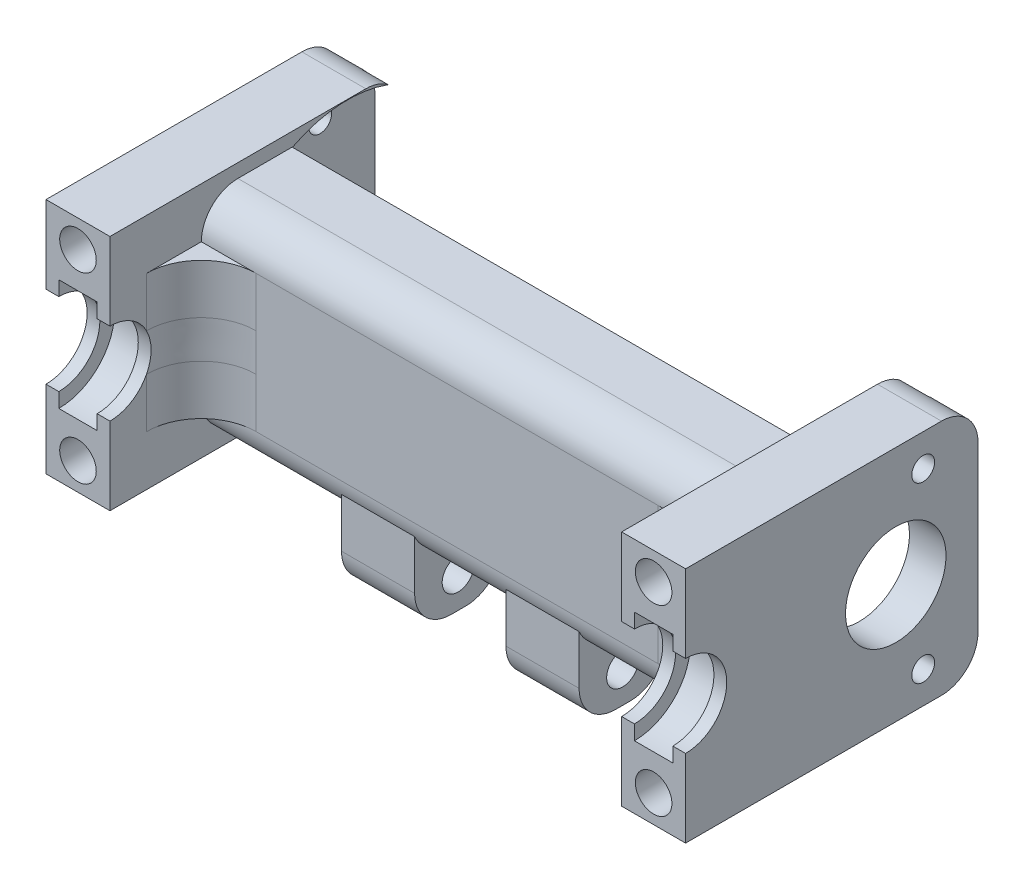
from build123d import *

# Parameters (mm, degrees)
SKETCH1_W                                  = 70
SKETCH1_H                                  = 15
BOSS_EXTRUDE1_DEPTH                        = 3
SKETCH2_W                                  = 7
SKETCH2_H                                  = 15
BOSS_EXTRUDE2_DEPTH                        = 10
SKETCH5_R                                  = 4.5
CUT_EXTRUDE1_DEPTH                         = 72.590851371
SKETCH6_R                                  = 6.1
CUT_EXTRUDE4_DEPTH                         = 2.1
BOSS_EXTRUDE3_DEPTH                        = 13
SKETCH8_R                                  = 2
CUT_EXTRUDE5_DEPTH                         = 40.534794802
SKETCH9_R                                  = 1.75
CUT_EXTRUDE6_DEPTH                         = 39.65229618
MIRROR1_AT_THE_SECOND_PLANE_COPY_1_SKETC_R = 6.1
MIRROR1_AT_THE_SECOND_PLANE_COPY_1_DEPTH   = 2.1
MIRROR1_AT_THE_SECOND_PLANE_COPY_2_DEPTH   = 13
MIRROR1_AT_THE_SECOND_PLANE_COPY_3_SKETC_R = 2
MIRROR1_AT_THE_SECOND_PLANE_COPY_3_DEPTH   = 40.534794802
MIRROR1_AT_THE_SECOND_PLANE_COPY_4_SKETC_R = 1.75
MIRROR1_AT_THE_SECOND_PLANE_COPY_4_DEPTH   = 39.65229618
FILLET1_R                                  = 6
SKETCH10_W                                 = 56
SKETCH10_H                                 = 23
BOSS_EXTRUDE4_DEPTH                        = 15
FILLET2_R                                  = 4
SKETCH11_R                                 = 13
CUT_EXTRUDE7_DEPTH                         = 66.627738058
SKETCH12_W                                 = 8
SKETCH12_H                                 = 9.596439054
BOSS_EXTRUDE5_DEPTH                        = 7
BOSS_EXTRUDE5_DIRECTION_2_REACH            = 46.657
FILLET3_R                                  = 4
SKETCH13_R                                 = 1.75
CUT_EXTRUDE8_DEPTH                         = 46.948340586
SKETCH14_W                                 = 7
SKETCH14_H                                 = 26
BOSS_EXTRUDE6_DEPTH                        = 5
SKETCH15_W                                 = 7
SKETCH15_H                                 = 26
BOSS_EXTRUDE7_DEPTH                        = 14
FILLET5_R                                  = 4
SKETCH16_R                                 = 5.5
CUT_EXTRUDE9_DEPTH                         = 75.854859562
FILLET3_OF_MIRROR2_R                       = 4
FILLET5_OF_MIRROR2_R                       = 4
SKETCH17_R                                 = 1.25
CUT_EXTRUDE10_DEPTH                        = 75.854859562
CUT_EXTRUDE14_DEPTH                        = 31
CUT_EXTRUDE14_DEPTH_BACK                   = 31
SKETCH18_R                                 = 12.95


with BuildPart() as part:
    # Sketch1 → Boss-Extrude1 (new body)
    with BuildSketch(Plane.XY):
        Rectangle(SKETCH1_W, SKETCH1_H)
    extrude(amount=BOSS_EXTRUDE1_DEPTH)

    # Sketch2 → Boss-Extrude2 (add)
    with BuildSketch(Plane.XY.offset(3)):
        with Locations((-31.5, 0)):
            Rectangle(SKETCH2_W, SKETCH2_H)
        with Locations((31.5, 0)):
            Rectangle(SKETCH2_W, SKETCH2_H)
    extrude(amount=BOSS_EXTRUDE2_DEPTH)

    # Sketch5 → Cut-Extrude1 (cut, through all)
    with BuildSketch(Plane(origin=(35, 0, 0), x_dir=(0, 0, -1), z_dir=(1, 0, 0))):
        with Locations((-13, 0)):
            Circle(SKETCH5_R)
    extrude(amount=-CUT_EXTRUDE1_DEPTH, mode=Mode.SUBTRACT)

    # Sketch6 → Cut-Extrude4 (cut, symmetric)
    with BuildSketch(Plane(origin=(31.5, 0, 0), x_dir=(0, 0, -1), z_dir=(1, 0, 0))):
        with Locations((-13, 0)):
            Circle(SKETCH6_R)
    cut_extrude4 = extrude(amount=CUT_EXTRUDE4_DEPTH, both=True, mode=Mode.SUBTRACT)

    # Sketch7 → Boss-Extrude3 (add)
    with BuildSketch(Plane.XY):
        Polygon((28, 8.1), (28, 13), (35, 13), (35, 8.1), (35, 4.5), (33.6, 4.5), (33.6, 6.1), (29.4, 6.1), (29.4, 4.5), (28, 4.5), align=None)
    boss_extrude3 = extrude(amount=BOSS_EXTRUDE3_DEPTH)

    # Sketch8 → Cut-Extrude5 (cut, symmetric)
    with BuildSketch(Plane.XY.offset(13)):
        with Locations((31.5, 10)):
            Circle(SKETCH8_R)
    cut_extrude5 = extrude(amount=CUT_EXTRUDE5_DEPTH, both=True, mode=Mode.SUBTRACT)

    # Sketch9 → Cut-Extrude6 (cut, through all)
    with BuildSketch(Plane.XY.offset(3)):
        with Locations((-10, -4)):
            Circle(SKETCH9_R)
    cut_extrude6 = extrude(amount=-CUT_EXTRUDE6_DEPTH, mode=Mode.SUBTRACT)

    # Mirror1: Cut-Extrude4, Boss-Extrude3, Cut-Extrude5, Cut-Extrude6 across plane
    add(cut_extrude4.mirror(Plane(origin=(0, 0, 0), x_dir=(0, 0, 1), z_dir=(1, 0, 0))), mode=Mode.SUBTRACT)
    add(boss_extrude3.mirror(Plane(origin=(0, 0, 0), x_dir=(0, 0, 1), z_dir=(1, 0, 0))))
    add(cut_extrude5.mirror(Plane(origin=(0, 0, 0), x_dir=(0, 0, 1), z_dir=(1, 0, 0))), mode=Mode.SUBTRACT)
    add(cut_extrude6.mirror(Plane(origin=(0, 0, 0), x_dir=(0, 0, 1), z_dir=(1, 0, 0))), mode=Mode.SUBTRACT)

    # Mirror1 at the second plane: Cut-Extrude4, Boss-Extrude3, Cut-Extrude5, Cut-Extrude6 across plane
    add(cut_extrude4.mirror(Plane.ZX), mode=Mode.SUBTRACT)
    add(boss_extrude3.mirror(Plane.ZX))
    add(cut_extrude5.mirror(Plane.ZX), mode=Mode.SUBTRACT)
    add(cut_extrude6.mirror(Plane.ZX), mode=Mode.SUBTRACT)

    # Mirror1 at the second plane copy 1 sketc → Mirror1 at the second plane copy 1 (cut, symmetric)
    with BuildSketch(Plane(origin=(-31.5, 0, 0), x_dir=(0, 0, -1), z_dir=(-1, 0, 0))):
        with Locations((-13, 0)):
            Circle(MIRROR1_AT_THE_SECOND_PLANE_COPY_1_SKETC_R)
    extrude(amount=MIRROR1_AT_THE_SECOND_PLANE_COPY_1_DEPTH, both=True, mode=Mode.SUBTRACT)

    # Mirror1 at the second plane copy 2 sketc → Mirror1 at the second plane copy 2 (add)
    with BuildSketch(Plane(origin=(0, 0, 0), x_dir=(-1, 0, 0), z_dir=(0, 0, 1))):
        Polygon((28, 8.1), (28, 13), (35, 13), (35, 8.1), (35, 4.5), (33.6, 4.5), (33.6, 6.1), (29.4, 6.1), (29.4, 4.5), (28, 4.5), align=None)
    extrude(amount=MIRROR1_AT_THE_SECOND_PLANE_COPY_2_DEPTH)

    # Mirror1 at the second plane copy 3 sketc → Mirror1 at the second plane copy 3 (cut, symmetric)
    with BuildSketch(Plane(origin=(0, 0, 13), x_dir=(-1, 0, 0), z_dir=(0, 0, 1))):
        with Locations((31.5, 10)):
            Circle(MIRROR1_AT_THE_SECOND_PLANE_COPY_3_SKETC_R)
    extrude(amount=MIRROR1_AT_THE_SECOND_PLANE_COPY_3_DEPTH, both=True, mode=Mode.SUBTRACT)

    # Mirror1 at the second plane copy 4 sketc → Mirror1 at the second plane copy 4 (cut, through all)
    with BuildSketch(Plane(origin=(0, 0, 3), x_dir=(-1, 0, 0), z_dir=(0, 0, 1))):
        with Locations((-10, -4)):
            Circle(MIRROR1_AT_THE_SECOND_PLANE_COPY_4_SKETC_R)
    extrude(amount=-MIRROR1_AT_THE_SECOND_PLANE_COPY_4_DEPTH, mode=Mode.SUBTRACT)

    # Fillet1
    fillet1_edges = [part.edges().sort_by_distance(p)[0] for p in [
        (-28, 0, 3),
        (28, 0, 3),
    ]]
    fillet(fillet1_edges, radius=FILLET1_R)

    # Sketch10 → Boss-Extrude4 (add)
    with BuildSketch(Plane(origin=(0, 0, 3), x_dir=(-1, 0, 0), z_dir=(0, 0, -1))):
        Rectangle(SKETCH10_W, SKETCH10_H)
    extrude(amount=BOSS_EXTRUDE4_DEPTH)

    # Fillet2
    # the kernel refuses this fillet: 4 mm, written as the material it takes off along each edge
    with BuildSketch(Plane(origin=(-28, 11.5, 3), x_dir=(0, 0, -1), z_dir=(1, 0, 0)), Plane(origin=(28, -11.5, 3), x_dir=(0, 0, -1), z_dir=(-1, 0, 0))) as fillet2_piece_1:
        with BuildLine():
            CenterArc((FILLET2_R, -FILLET2_R), FILLET2_R, 90, 90)
            Line((0, -FILLET2_R), (0, 0))
            Line((0, 0), (FILLET2_R, 0))
        make_face()
    extrude(amount=56, mode=Mode.SUBTRACT)

    # Sketch11 → Cut-Extrude7 (cut, through all)
    with BuildSketch(Plane(origin=(28, 0, 0), x_dir=(0, 0, -1), z_dir=(1, 0, 0))):
        with Locations((13, 0)):
            Circle(SKETCH11_R)
    extrude(amount=-CUT_EXTRUDE7_DEPTH, mode=Mode.SUBTRACT)

    # Sketch12 → Boss-Extrude5 (add)
    with BuildSketch(Plane.XZ.offset(11.5)):
        with Locations((-9, -2.139602647)):
            Rectangle(SKETCH12_W, SKETCH12_H)
    boss_extrude5 = extrude(amount=BOSS_EXTRUDE5_DEPTH)

    # Sketch12 → Boss-Extrude5 direction 2 (add, up to next)
    with BuildSketch(Plane.XZ.offset(11.5), mode=Mode.PRIVATE) as boss_extrude5_direction_2_sk1:
        with Locations((-9, -2.139602647)):
            Rectangle(SKETCH12_W, SKETCH12_H)
    boss_extrude5_direction_2_tool1 = extrude(boss_extrude5_direction_2_sk1.sketch, amount=-BOSS_EXTRUDE5_DIRECTION_2_REACH, mode=Mode.PRIVATE) - part.part
    boss_extrude5_direction_2 = boss_extrude5_direction_2_tool1.solids().sort_by_distance((-9, -11.5, -2.139603))[0]
    add(boss_extrude5_direction_2)

    # Fillet3
    fillet3_edges = [part.edges().sort_by_distance(p)[0] for p in [
        (-9, -18.5, 2.65861688),
        (-9, -18.5, -6.937822174),
    ]]
    fillet(fillet3_edges, radius=FILLET3_R)

    # Sketch13 → Cut-Extrude8 (cut, through all)
    with BuildSketch(Plane(origin=(-5, 0, 0), x_dir=(0, 0, -1), z_dir=(1, 0, 0))):
        with Locations((2.108513734, -15)):
            Circle(SKETCH13_R)
    cut_extrude8 = extrude(amount=-CUT_EXTRUDE8_DEPTH, mode=Mode.SUBTRACT)

    # Sketch14 → Boss-Extrude6 (add)
    with BuildSketch(Plane(origin=(0, 0, 0), x_dir=(-1, 0, 0), z_dir=(0, 0, -1))):
        with Locations((31.5, 0)):
            Rectangle(SKETCH14_W, SKETCH14_H)
    boss_extrude6 = extrude(amount=BOSS_EXTRUDE6_DEPTH)

    # Sketch15 → Boss-Extrude7 (add)
    with BuildSketch(Plane(origin=(0, 0, -5), x_dir=(-1, 0, 0), z_dir=(0, 0, -1))):
        with Locations((31.5, 0)):
            Rectangle(SKETCH15_W, SKETCH15_H)
    boss_extrude7 = extrude(amount=BOSS_EXTRUDE7_DEPTH)

    # Fillet5
    fillet5_edges = [part.edges().sort_by_distance(p)[0] for p in [
        (-31.5, 13, -19),
        (-31.5, -13, -19),
    ]]
    fillet(fillet5_edges, radius=FILLET5_R)

    # Sketch16 → Cut-Extrude9 (cut, through all)
    with BuildSketch(Plane.ZY.offset(35)):
        with Locations((-10, 0)):
            Circle(SKETCH16_R)
    cut_extrude9 = extrude(amount=-CUT_EXTRUDE9_DEPTH, mode=Mode.SUBTRACT)

    # Mirror2: Boss-Extrude5, Boss-Extrude5 direction 2, Cut-Extrude8, Boss-Extrude6, Boss-Extrude7, Cut-Extrude9 across plane
    add(boss_extrude5.mirror(Plane(origin=(0, 0, 0), x_dir=(0, 0, 1), z_dir=(1, 0, 0))))
    add(boss_extrude5_direction_2.mirror(Plane(origin=(0, 0, 0), x_dir=(0, 0, 1), z_dir=(1, 0, 0))))
    add(cut_extrude8.mirror(Plane(origin=(0, 0, 0), x_dir=(0, 0, 1), z_dir=(1, 0, 0))), mode=Mode.SUBTRACT)
    add(boss_extrude6.mirror(Plane(origin=(0, 0, 0), x_dir=(0, 0, 1), z_dir=(1, 0, 0))))
    add(boss_extrude7.mirror(Plane(origin=(0, 0, 0), x_dir=(0, 0, 1), z_dir=(1, 0, 0))))
    add(cut_extrude9.mirror(Plane(origin=(0, 0, 0), x_dir=(0, 0, 1), z_dir=(1, 0, 0))), mode=Mode.SUBTRACT)

    # Fillet3 of Mirror2
    fillet3_of_mirror2_edges = [part.edges().sort_by_distance(p)[0] for p in [
        (9, -18.5, 2.65861688),
        (9, -18.5, -6.937822174),
    ]]
    fillet(fillet3_of_mirror2_edges, radius=FILLET3_OF_MIRROR2_R)

    # Fillet5 of Mirror2
    fillet5_of_mirror2_edges = [part.edges().sort_by_distance(p)[0] for p in [
        (31.5, 13, -19),
        (31.5, -13, -19),
    ]]
    fillet(fillet5_of_mirror2_edges, radius=FILLET5_OF_MIRROR2_R)

    # Sketch17 → Cut-Extrude10 (cut, through all)
    with BuildSketch(Plane.ZY.offset(35)):
        with Locations((-13, 9.5)):
            Circle(SKETCH17_R)
        with Locations((-13, -9.5)):
            Circle(SKETCH17_R)
    extrude(amount=-CUT_EXTRUDE10_DEPTH, mode=Mode.SUBTRACT)

    # Sketch18 → Cut-Extrude14 (cut, two sides: drawn at the far end of the back side and taken through both)
    with BuildSketch(Plane(origin=(0, 0, 0), x_dir=(0, 0, -1), z_dir=(1, 0, 0)).offset(-CUT_EXTRUDE14_DEPTH_BACK)):
        with Locations((13, 0)):
            Circle(SKETCH18_R)
    extrude(amount=CUT_EXTRUDE14_DEPTH + CUT_EXTRUDE14_DEPTH_BACK, mode=Mode.SUBTRACT)


solid = part.part
